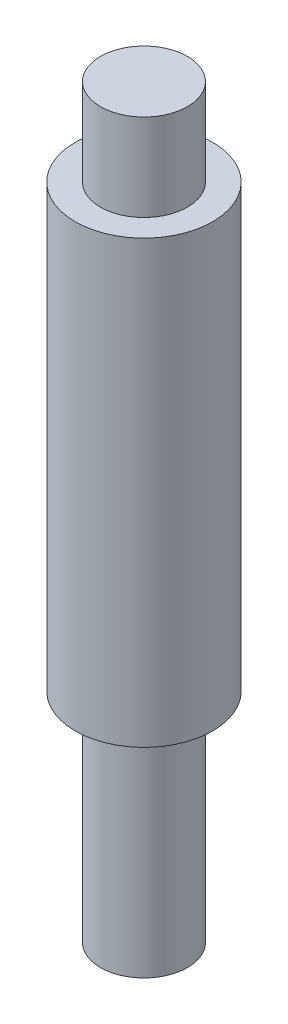
from build123d import *

# Parameters (mm, degrees)
SKETCH1_R                  = 6.35
BUSHINGSPROCKETSPACE_DEPTH = 31.75
SKETCH2_R                  = 10.033
BOSS_EXTRUDE2_DEPTH        = 64.3509
SKETCH3_R                  = 6.35
BOSS_EXTRUDE3_DEPTH        = 12.7


with BuildPart() as part:
    # Sketch1 → BushingSprocketSpace (new body)
    with BuildSketch(Plane(origin=(0, 0, 0), x_dir=(1, 0, 0), z_dir=(0, 1, 0))):
        Circle(SKETCH1_R)
    extrude(amount=BUSHINGSPROCKETSPACE_DEPTH)

    # Sketch2 → Boss-Extrude2 (add)
    with BuildSketch(Plane(origin=(0, 31.75, 0), x_dir=(1, 0, 0), z_dir=(0, 1, 0))):
        Circle(SKETCH2_R)
    extrude(amount=BOSS_EXTRUDE2_DEPTH)

    # Sketch3 → Boss-Extrude3 (add)
    with BuildSketch(Plane(origin=(0, 96.1009, 0), x_dir=(1, 0, 0), z_dir=(0, 1, 0))):
        Circle(SKETCH3_R)
    extrude(amount=BOSS_EXTRUDE3_DEPTH)


solid = part.part
